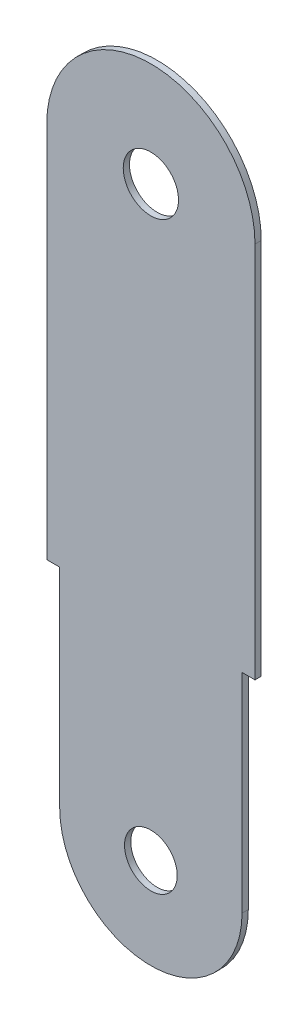
from build123d import *

# Parameters (mm, degrees)
SKETCH1_R           = 6.7437
SKETCH1_R_2         = 6.4262
BOSS_EXTRUDE1_DEPTH = 1.524


with BuildPart() as part:
    # Sketch1 → Boss-Extrude1 (new body)
    with BuildSketch(Plane.XY):
        with BuildLine():
            Line((-34.05306863, -35.011654825), (-34.05306863, -127.07412464))
            Line((-34.05306863, -127.07412464), (-37.211326197, -127.07412464))
            Line((-37.211326197, -127.07412464), (-37.211326197, -177.922739557))
            ThreePointArc((-37.211326197, -177.922739557), (-59.45306863, -200.164481989), (-81.694811062, -177.922739557))
            Line((-81.694811062, -177.922739557), (-81.694811062, -127.07412464))
            Line((-81.694811062, -127.07412464), (-84.85306863, -127.07412464))
            Line((-84.85306863, -127.07412464), (-84.85306863, -35.011654825))
            ThreePointArc((-84.85306863, -35.011654825), (-59.45306863, -9.611654825), (-34.05306863, -35.011654825))
        make_face()
        with Locations((-59.45306863, -35.011654825)):
            Circle(SKETCH1_R, mode=Mode.SUBTRACT)
        with Locations((-59.45306863, -177.922739557)):
            Circle(SKETCH1_R_2, mode=Mode.SUBTRACT)
    extrude(amount=BOSS_EXTRUDE1_DEPTH)


solid = part.part
